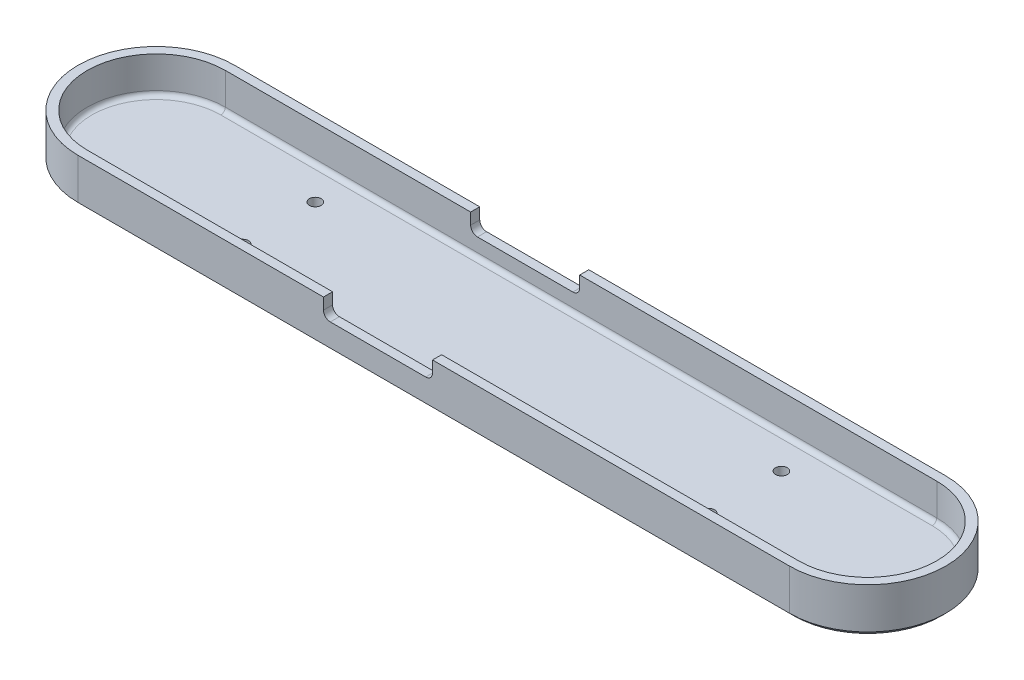
from build123d import *

# Parameters (mm, degrees)
MAINBLOCK_DEPTH               = 2.54
BOSS_EXTRUDE1_DEPTH           = 12.7
SKETCH3_R                     = 1.651
MOUNT_HOLES_DEPTH             = 124.889069578
FILLET1_R                     = 1.27
CHAMFER1_SIZE                 = 1.27
SKETCH4_W                     = 30.48
SKETCH4_H                     = 2.54
STABILIZER_MOUNT_CUTOUT_DEPTH = 5.08
FILLET2_R                     = 1.905


with BuildPart() as part:
    # Sketch1 → MainBlock (new body)
    with BuildSketch(Plane(origin=(0, 0, 0), x_dir=(1, 0, 0), z_dir=(0, 1, 0))):
        with BuildLine():
            Line((-99.441, 19.304), (99.441, 19.304))
            ThreePointArc((99.441, 19.304), (118.745, 0), (99.441, -19.304))
            Line((99.441, -19.304), (-99.441, -19.304))
            ThreePointArc((-99.441, -19.304), (-118.745, 0), (-99.441, 19.304))
        make_face()
    extrude(amount=MAINBLOCK_DEPTH)

    # Sketch2 → Boss-Extrude1 (add)
    with BuildSketch(Plane.XZ):
        with BuildLine():
            Line((-99.441, 21.844), (99.441, 21.844))
            ThreePointArc((99.441, 21.844), (121.285, 0), (99.441, -21.844))
            Line((99.441, -21.844), (-99.441, -21.844))
            ThreePointArc((-99.441, -21.844), (-121.285, 0), (-99.441, 21.844))
        make_face()
        with BuildLine():
            Line((99.441, 19.304), (-99.441, 19.304))
            ThreePointArc((-99.441, 19.304), (-118.745, 0), (-99.441, -19.304))
            Line((-99.441, -19.304), (99.441, -19.304))
            ThreePointArc((99.441, -19.304), (118.745, 0), (99.441, 19.304))
        make_face(mode=Mode.SUBTRACT)
    extrude(amount=-BOSS_EXTRUDE1_DEPTH)

    # Sketch3 → Mount-Holes (cut, through all)
    with BuildSketch(Plane.XZ):
        with Locations((-65.151, 10.16)):
            Circle(SKETCH3_R)
        with Locations((65.151, 10.16)):
            Circle(SKETCH3_R)
        with Locations((65.151, -10.16)):
            Circle(SKETCH3_R)
        with Locations((-65.151, -10.16)):
            Circle(SKETCH3_R)
    extrude(amount=-MOUNT_HOLES_DEPTH, mode=Mode.SUBTRACT)

    # Fillet1
    fillet1_edges = [part.edges().sort_by_distance(p)[0] for p in [
        (118.745, 2.54, 0),
        (0, 2.54, 19.304),
        (-118.745, 2.54, 0),
        (0, 2.54, -19.304),
    ]]
    fillet(fillet1_edges, radius=FILLET1_R)

    # Chamfer1
    chamfer1_edges = [part.edges().sort_by_distance(p)[0] for p in [
        (0, 0, 21.844),
        (-121.285, 0, 0),
        (121.285, 0, 0),
        (0, 0, -21.844),
    ]]
    chamfer(chamfer1_edges, length=CHAMFER1_SIZE)

    # Sketch4 → Stabilizer-Mount-Cutout (cut)
    with BuildSketch(Plane(origin=(0, 12.7, 0), x_dir=(1, 0, 0), z_dir=(0, 1, 0))):
        with Locations((-15.621, 20.574)):
            Rectangle(SKETCH4_W, SKETCH4_H)
    stabilizer_mount_cutout = extrude(amount=-STABILIZER_MOUNT_CUTOUT_DEPTH, mode=Mode.SUBTRACT)

    # Mirror1: Stabilizer-Mount-Cutout across plane
    add(stabilizer_mount_cutout.mirror(Plane.XY), mode=Mode.SUBTRACT)

    # Fillet2
    fillet2_edges = [part.edges().sort_by_distance(p)[0] for p in [
        (-0.381, 7.62, -20.574),
        (-30.861, 7.62, -20.574),
        (-30.861, 7.62, 20.574),
        (-0.381, 7.62, 20.574),
    ]]
    fillet(fillet2_edges, radius=FILLET2_R)


solid = part.part
